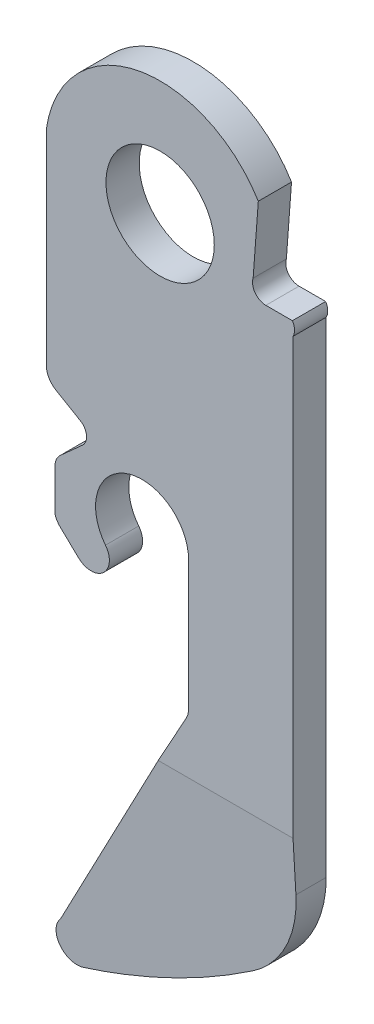
from build123d import *

# Parameters (mm, degrees)
BOSS_EXTRUDE1_DEPTH = 1.27
SKETCH2_R           = 2.0701
CUT_EXTRUDE1_DEPTH  = 96.856646382
FILLET1_R           = 0.762
CUT_EXTRUDE2_DEPTH  = 66.762498414


with BuildPart() as part:
    # Sketch1 → Boss-Extrude1 (new body)
    with BuildSketch(Plane.XY):
        with BuildLine():
            Line((70.330739592, 59.139101988), (70.330739592, 40.597101988))
            ThreePointArc((70.330739592, 40.597101988), (69.835174035, 38.588590366), (68.462226886, 37.041101988))
            ThreePointArc((68.462226886, 37.041101988), (65.254229959, 35.152900088), (61.810725113, 33.739101988))
            ThreePointArc((61.810725113, 33.739101988), (60.934072709, 34.04634123), (61.005757252, 34.972503589))
            Line((61.005757252, 34.972503589), (66.339757252, 44.624503589))
            Line((66.339757252, 44.624503589), (66.339757252, 44.661101988))
            Line((66.339757252, 44.661101988), (66.339757252, 49.741101988))
            ThreePointArc((66.339757252, 49.741101988), (63.981284206, 51.421677794), (63.162777451, 48.643769077))
            ThreePointArc((63.162777451, 48.643769077), (63.082845223, 47.697433256), (62.133211353, 47.709101988))
            Line((62.133211353, 47.709101988), (61.440739592, 48.369501988))
            ThreePointArc((61.440739592, 48.369501988), (61.310918169, 48.532759321), (61.230228281, 48.725101988))
            Line((61.230228281, 48.725101988), (61.230228281, 50.284836857))
            ThreePointArc((61.230228281, 50.284836857), (61.28523892, 50.543366046), (61.440739592, 50.757101988))
            Line((61.440739592, 50.757101988), (62.28111765, 51.512463662))
            ThreePointArc((62.28111765, 51.512463662), (62.437208569, 51.916695523), (62.202739592, 52.281101988))
            Line((62.202739592, 52.281101988), (60.899029413, 53.043101988))
            Line((60.899029413, 53.043101988), (60.899029413, 61.272701988))
            ThreePointArc((60.899029413, 61.272701988), (64.360646919, 64.96620885), (69.003498263, 62.949101988))
            Line((69.003498263, 62.949101988), (68.806739592, 60.307501988))
            ThreePointArc((68.806739592, 60.307501988), (68.881778013, 59.854565135), (69.291340707, 59.647101988))
            Line((69.291340707, 59.647101988), (70.307340707, 59.647101988))
            ThreePointArc((70.307340707, 59.647101988), (70.387182588, 59.396240683), (70.330739592, 59.139101988))
        make_face()
    extrude(amount=BOSS_EXTRUDE1_DEPTH)

    # Sketch2 → Cut-Extrude1 (cut, through all)
    with BuildSketch(Plane.XY.offset(1.27)):
        with Locations((65.250739592, 60.663101988)):
            Circle(SKETCH2_R)
    extrude(amount=-CUT_EXTRUDE1_DEPTH, mode=Mode.SUBTRACT)

    # Fillet1
    fillet1_edges = [part.edges().sort_by_distance(p)[0] for p in [
        (60.899029413, 53.043101988, 0.635),
        (66.339757252, 44.624503589, 0.635),
    ]]
    fillet(fillet1_edges, radius=FILLET1_R)

    # Sketch3 → Cut-Extrude2 (cut, through all)
    with BuildSketch(Plane(origin=(70.330739592, 0, 0), x_dir=(0, 0, -1), z_dir=(1, 0, 0))):
        Polygon((-1.27, 33.700806157), (-0.762, 33.700806157), (-1.27, 42.525640105), align=None)
    extrude(amount=-CUT_EXTRUDE2_DEPTH, mode=Mode.SUBTRACT)


solid = part.part
